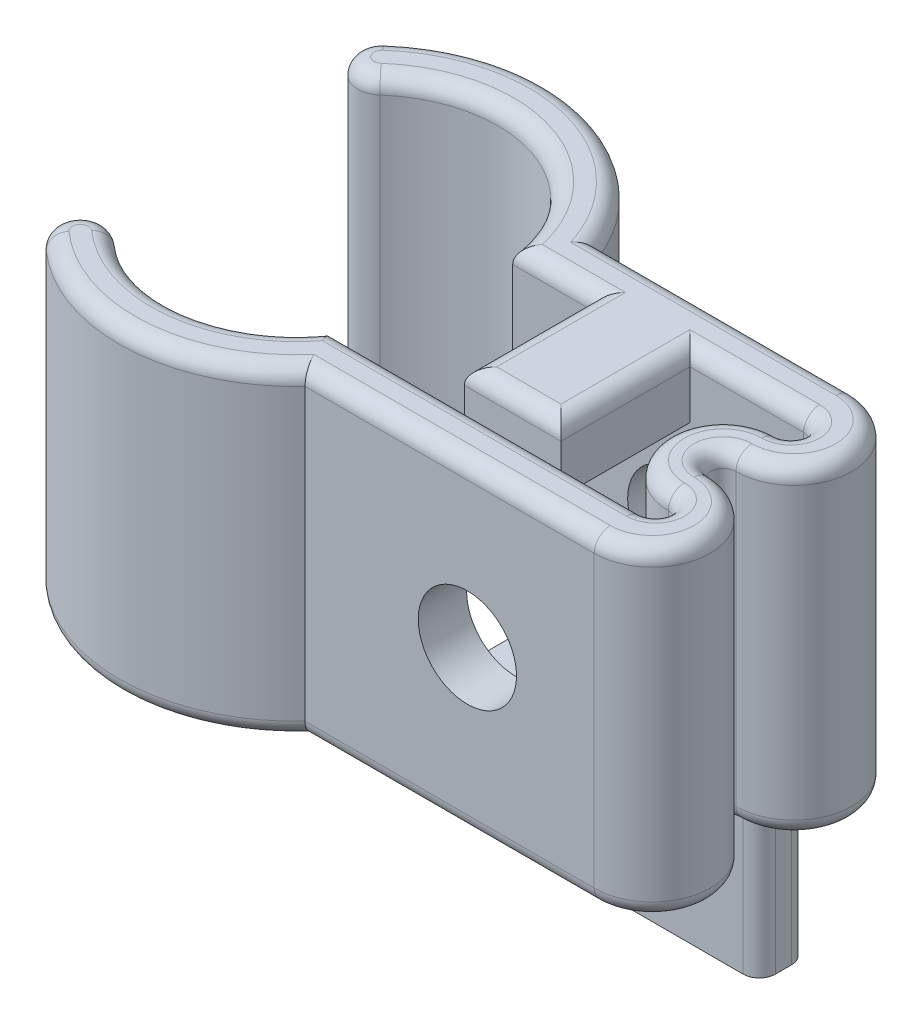
from build123d import *

# Parameters (mm, degrees)
BOSS_EXTRUDE1_DEPTH = 20
CUT_EXTRUDE1_DEPTH  = 1.5
SKETCH3_R           = 3.05
CUT_EXTRUDE2_DEPTH  = 41.00199995
SKETCH4_W           = 6
SKETCH4_H           = 4
BOSS_EXTRUDE2_DEPTH = 8
FILLET1_R           = 1
SKETCH6_W           = 12
SKETCH6_H           = 3
BOSS_EXTRUDE3_DEPTH = 12
SKETCH7_R           = 3.95
CUT_EXTRUDE3_DEPTH  = 1
SKETCH8_R           = 2.05
CUT_EXTRUDE4_DEPTH  = 41.229466908
FILLET3_R           = 1
FILLET4_R           = 1
FILLET6_R           = 1


with BuildPart() as part:
    # Sketch1 → Boss-Extrude1 (new body)
    with BuildSketch(Plane(origin=(0, 0, 0), x_dir=(1, 0, 0), z_dir=(0, 1, 0))):
        with BuildLine():
            Line((26, 3), (7.937253933, 3))
            ThreePointArc((7.937253933, 3), (2.823124054, 9.485316999), (-5.3, 7.992495307))
            ThreePointArc((-5.3, 7.992495307), (-7.41734287, 8.122338177), (-7.2875, 10.239681047))
            ThreePointArc((-7.2875, 10.239681047), (2.58521006, 12.691898285), (10.246950766, 6))
            Line((10.246950766, 6), (26, 6))
            ThreePointArc((26, 6), (29.6, 2.4), (26, -1.2))
            ThreePointArc((26, -1.2), (25.2, -2), (26, -2.8))
            ThreePointArc((26, -2.8), (29.6, -6.4), (26, -10))
            Line((26, -10), (8.04673847, -10))
            ThreePointArc((8.04673847, -10), (0.529993185, -13.487224728), (-7.2875, -10.739681047))
            ThreePointArc((-7.2875, -10.739681047), (-7.41734287, -8.622338177), (-5.3, -8.492495307))
            ThreePointArc((-5.3, -8.492495307), (0.994375746, -10.437960498), (6.614378278, -7))
            Line((6.614378278, -7), (26, -7))
            ThreePointArc((26, -7), (26.8, -6.2), (26, -5.4))
            ThreePointArc((26, -5.4), (22.6, -2), (26, 1.4))
            ThreePointArc((26, 1.4), (26.8, 2.2), (26, 3))
        make_face()
    extrude(amount=BOSS_EXTRUDE1_DEPTH)

    # Sketch2 → Cut-Extrude1 (cut)
    with BuildSketch(Plane(origin=(0, 0, -6), x_dir=(-1, 0, 0), z_dir=(0, 0, -1))):
        Polygon((-18.123475383, 3.572649731), (-12.557226771, 6.786324865), (-12.557226771, 13.213675135), (-18.123475383, 16.427350269), (-23.689723995, 13.213675135), (-23.689723995, 6.786324865), align=None)
    extrude(amount=-CUT_EXTRUDE1_DEPTH, mode=Mode.SUBTRACT)

    # Sketch3 → Cut-Extrude2 (cut, through all)
    with BuildSketch(Plane(origin=(0, 0, -4.5), x_dir=(-1, 0, 0), z_dir=(0, 0, -1))):
        with Locations((-18.123475383, 10)):
            Circle(SKETCH3_R)
    extrude(amount=-CUT_EXTRUDE2_DEPTH, mode=Mode.SUBTRACT)

    # Sketch4 → Boss-Extrude2 (add)
    with BuildSketch(Plane.XY.offset(-3)):
        with Locations((15.937253933, 18)):
            Rectangle(SKETCH4_W, SKETCH4_H)
        with Locations((15.937253933, 2)):
            Rectangle(SKETCH4_W, SKETCH4_H)
    extrude(amount=BOSS_EXTRUDE2_DEPTH)

    # Fillet1
    fillet1_edges = [part.edges().sort_by_distance(p)[0] for p in [
        (26.8, 20, -2.2),
        (22.6, 20, 2),
        (26.8, 20, 6.2),
        (16.307189139, 20, 7),
        (0.994375746, 20, 10.437960498),
        (-7.41734287, 20, 8.622338177),
        (0.529993185, 20, 13.487224728),
        (17.023369235, 20, 10),
        (29.6, 20, 6.4),
        (25.2, 20, 2),
        (2.823124054, 20, -9.485316999),
        (29.6, 20, -2.4),
        (18.123475383, 20, -6),
        (2.58521006, 20, -12.691898285),
        (-7.41734287, 20, -8.122338177),
        (10.437253933, 20, -3),
        (22.468626967, 20, -3),
        (12.937253933, 20, 1),
        (18.937253933, 20, 1),
        (15.937253933, 20, 5),
    ]]
    fillet(fillet1_edges, radius=FILLET1_R)

    # Sketch6 → Boss-Extrude3 (add)
    with BuildSketch(Plane.XZ):
        with Locations((17.246950766, -4.5)):
            Rectangle(SKETCH6_W, SKETCH6_H)
    extrude(amount=BOSS_EXTRUDE3_DEPTH)

    # Sketch7 → Cut-Extrude3 (cut)
    with BuildSketch(Plane(origin=(0, 0, -6), x_dir=(-1, 0, 0), z_dir=(0, 0, -1))):
        with Locations((-17.246950766, -6)):
            Circle(SKETCH7_R)
    extrude(amount=-CUT_EXTRUDE3_DEPTH, mode=Mode.SUBTRACT)

    # Sketch8 → Cut-Extrude4 (cut, through all)
    with BuildSketch(Plane(origin=(0, 0, -5), x_dir=(-1, 0, 0), z_dir=(0, 0, -1))):
        with Locations((-17.246950766, -6)):
            Circle(SKETCH8_R)
    extrude(amount=-CUT_EXTRUDE4_DEPTH, mode=Mode.SUBTRACT)

    # Fillet3
    fillet3_edges = [part.edges().sort_by_distance(p)[0] for p in [
        (-7.41734287, 0, -8.122338177),
        (2.58521006, 0, -12.691898285),
        (10.746950766, 0, -6),
        (11.246950766, 0, -4.5),
        (11.246950766, -6, -3),
        (11.246950766, -6, -6),
        (9.59210235, 0, -3),
        (2.823124054, 0, -9.485316999),
    ]]
    fillet(fillet3_edges, radius=FILLET3_R - 0.0001)  # a hair under: the kernel refuses the full size

    # Fillet4
    fillet4_edges = [part.edges().sort_by_distance(p)[0] for p in [
        (24.623475383, 0, -6),
        (29.6, 0, -2.4),
        (24.623475383, 0, -3),
        (25.2, 0, 2),
        (23.246950766, 0, -4.5),
        (23.246950766, -6, -6),
        (23.246950766, -6, -3),
        (29.6, 0, 6.4),
        (17.023369235, 0, 10),
        (0.529993185, 0, 13.487224728),
        (-7.41734287, 0, 8.622338177),
        (0.994375746, 0, 10.437960498),
        (16.307189139, 0, 7),
        (26.8, 0, 6.2),
        (22.6, 0, 2),
        (26.8, 0, -2.2),
    ]]
    fillet(fillet4_edges, radius=FILLET4_R)

    # Fillet6
    fillet6_edges = [part.edges().sort_by_distance(p)[0] for p in [
        (18.937253933, 0, 1),
        (12.937253933, 0, 1),
        (15.937253933, 0, 5),
    ]]
    fillet(fillet6_edges, radius=FILLET6_R)


solid = part.part
